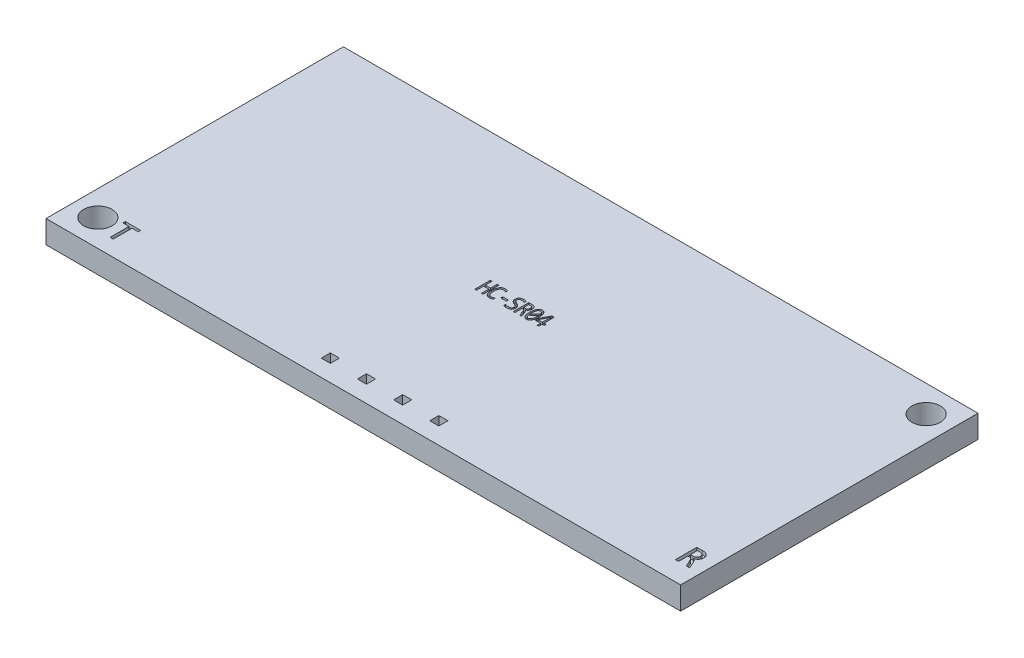
from build123d import *

# Parameters (mm, degrees)
CROQUIS1_W                = 44.6
CROQUIS1_H                = 20.9
CROQUIS1_R                = 1
SALIENTE_EXTRUIR2_DEPTH   = 1.6
CROQUIS3_W                = 0.396538249
CROQUIS3_H                = 0.136456535
CORTAR_EXTRUIR1_DEPTH     = 1
CORTAR_EXTRUIR2_DEPTH     = 1
CORTAR_EXTRUIR4_START     = 19.087831133
CORTAR_EXTRUIR4_OUTLINE_W = 0.636
CORTAR_EXTRUIR4_OUTLINE_H = 1.6
CORTAR_EXTRUIR4_DEPTH     = 0.636


# Read off the part's stored shape, not the designer's step: Cortar-Extruir4
with BuildPart() as part:
    # Croquis1 → Saliente-Extruir2 (new body)
    with BuildSketch(Plane(origin=(0, 0, 0), x_dir=(1, 0, 0), z_dir=(0, 1, 0))):
        with Locations((22.3, -10.45)):
            Rectangle(CROQUIS1_W, CROQUIS1_H)
        with Locations(Location((42.832264729, -1.877461796, 0), (0, 0, 90))):
            Circle(CROQUIS1_R, mode=Mode.SUBTRACT)
        with Locations(Location((1.767735271, -19.022538204, 0), (0, 0, 90))):
            Circle(CROQUIS1_R, mode=Mode.SUBTRACT)
    extrude(amount=SALIENTE_EXTRUIR2_DEPTH)

    # Croquis3 → Cortar-Extruir1 (cut)
    # profile 1 of 7: a face of its own
    with BuildSketch(Plane(origin=(0, 2.345630412, 0), x_dir=(1, 0, 0), z_dir=(0, 1, 0))):
        Polygon((19.973748759, -10.139175078), (19.85555223, -10.139175078), (19.85555223, -9.639492469), (19.491585885, -9.639492469), (19.491585885, -10.139175078), (19.373389357, -10.139175078), (19.373389357, -9.050730638), (19.491585885, -9.050730638), (19.491585885, -9.51117891), (19.85555223, -9.51117891), (19.85555223, -9.050730638), (19.973748759, -9.050730638), align=None)
    # profile 2 of 7: a face of its own
    with BuildSketch(Plane(origin=(0, 2.345630412, 0), x_dir=(1, 0, 0), z_dir=(0, 1, 0))):
        with BuildLine():
            add(Edge.make_bspline(
                [(20.627703747, -10.098460199), (20.610374513, -10.106830785), (20.576036478, -10.123417178), (20.521537795, -10.13980278), (20.466007679, -10.15052594), (20.428456832, -10.151839364), (20.409570697, -10.152499948)],
                knots=[0, 0, 0, 0, 1.016780851, 2.014760397, 3.001527137, 4, 4, 4, 4], degree=3))
            add(Edge.make_bspline(
                [(20.409570697, -10.152499948), (20.39465692, -10.15208389), (20.365590337, -10.151273003), (20.323405168, -10.144666469), (20.283735218, -10.13430462), (20.247044332, -10.118639649), (20.212594877, -10.099464237), (20.181120791, -10.075470597), (20.152214016, -10.047356337), (20.126323979, -10.014735686), (20.103006446, -9.978093614), (20.083106594, -9.937139926), (20.066300287, -9.892082291), (20.052668938, -9.842929051), (20.041790124, -9.789759097), (20.034348825, -9.73244375), (20.029538344, -9.671077827), (20.029067385, -9.628727093), (20.028824886, -9.606920565)],
                knots=[0, 0, 0, 0, 0.94991527, 1.851361422, 2.714727474, 3.555816217, 4.386716741, 5.22119729, 6.070041165, 6.950049518, 7.869063253, 8.832533837, 9.846022192, 10.929629904, 12.079947647, 13.301629003, 14.610600194, 16, 16, 16, 16], degree=3))
            add(Edge.make_bspline(
                [(20.028824886, -9.606920565), (20.02913283, -9.585605251), (20.029734219, -9.543978285), (20.035105795, -9.483180513), (20.043285805, -9.425527066), (20.055130364, -9.371190298), (20.070082002, -9.320362586), (20.088050162, -9.273275756), (20.108975535, -9.230214175), (20.132776184, -9.19121476), (20.159158875, -9.156100442), (20.188594306, -9.125492122), (20.220573705, -9.098916173), (20.25512076, -9.076612268), (20.292290991, -9.059037637), (20.331652122, -9.046310054), (20.373254643, -9.038766749), (20.401725625, -9.037865171), (20.416233132, -9.037405769)],
                knots=[0, 0, 0, 0, 1.327786852, 2.593052837, 3.799758175, 4.953719228, 6.054723051, 7.097814213, 8.090224973, 9.033298557, 9.940388262, 10.821139437, 11.672830083, 12.525753277, 13.376225029, 14.227067261, 15.096594778, 16, 16, 16, 16], degree=3))
            add(Edge.make_bspline(
                [(20.416233132, -9.037405769), (20.42610961, -9.037519394), (20.445565766, -9.037743231), (20.47414272, -9.04035822), (20.501702747, -9.044166247), (20.528193107, -9.049998382), (20.554088594, -9.057023787), (20.579125828, -9.066310923), (20.603893666, -9.076847165), (20.619705732, -9.08539472), (20.627703747, -9.08971822)],
                knots=[0, 0, 0, 0, 1.075434393, 2.11855081, 3.123295064, 4.103821156, 5.071119399, 6.04321857, 7.010226339, 8, 8, 8, 8], degree=3))
            Line((20.627703747, -9.08971822), (20.627703747, -9.235551515))
            add(Edge.make_bspline(
                [(20.627703747, -9.235551515), (20.619883315, -9.230327988), (20.604405836, -9.219990064), (20.580041401, -9.206768575), (20.555508459, -9.195053097), (20.53031524, -9.185621299), (20.504425004, -9.178129406), (20.477451322, -9.172694419), (20.449215803, -9.169416003), (20.429978142, -9.169092111), (20.420181241, -9.168927167)],
                knots=[0, 0, 0, 0, 1.018287338, 2.015300564, 2.999852889, 3.961395426, 4.92586479, 5.916687188, 6.939059753, 8, 8, 8, 8], degree=3))
            add(Edge.make_bspline(
                [(20.420181241, -9.168927167), (20.410201474, -9.169219047), (20.390661782, -9.169790529), (20.362032571, -9.175502999), (20.334895409, -9.184577407), (20.309213511, -9.197255313), (20.285522301, -9.213519679), (20.263242115, -9.2325703), (20.243291387, -9.255352245), (20.224949653, -9.28110542), (20.208755862, -9.310014929), (20.194625881, -9.342034766), (20.182435562, -9.376959121), (20.172036434, -9.414861319), (20.163922604, -9.455589523), (20.158395641, -9.499211419), (20.154893853, -9.545503213), (20.154420091, -9.577303214), (20.154177363, -9.593595696)],
                knots=[0, 0, 0, 0, 0.855273281, 1.674565732, 2.493523833, 3.304569701, 4.122676115, 4.953136449, 5.812823174, 6.713525341, 7.661447009, 8.65019893, 9.712535881, 10.832132285, 12.019525658, 13.272043004, 14.602352584, 16, 16, 16, 16], degree=3))
            add(Edge.make_bspline(
                [(20.154177363, -9.593595696), (20.154338864, -9.610709093), (20.15465208, -9.64389894), (20.15785116, -9.692006917), (20.163284456, -9.736805926), (20.17054721, -9.778381505), (20.180092772, -9.816769082), (20.191973021, -9.851888656), (20.205603043, -9.883931085), (20.221802242, -9.912456656), (20.239713442, -9.937951949), (20.2601867, -9.959684595), (20.282222121, -9.978615183), (20.306664603, -9.993580013), (20.332842984, -10.005720395), (20.361124586, -10.013971468), (20.391376179, -10.019025446), (20.412182096, -10.019663152), (20.422895567, -10.019991523)],
                knots=[0, 0, 0, 0, 1.444903631, 2.802256698, 4.068620316, 5.253899802, 6.363986019, 7.405050103, 8.381782208, 9.299254532, 10.170420753, 11.00583044, 11.814182952, 12.6159143, 13.417765975, 14.244002075, 15.095794184, 16, 16, 16, 16], degree=3))
            add(Edge.make_bspline(
                [(20.422895567, -10.019991523), (20.432031583, -10.01979181), (20.450269116, -10.019393139), (20.477288006, -10.016501149), (20.50369148, -10.011086348), (20.538276668, -10.002004237), (20.580458114, -9.985501774), (20.611868398, -9.967582824), (20.627703747, -9.958549068)],
                knots=[0, 0, 0, 0, 0.759244976, 1.51562283, 2.254279774, 2.997099975, 4.486101878, 6, 6, 6, 6], degree=3))
            Line((20.627703747, -9.958549068), (20.627703747, -10.098460199))
        make_face()
    # profile 3 of 7: a face of its own
    with BuildSketch(Plane(origin=(0, 2.345630412, 0), x_dir=(1, 0, 0), z_dir=(0, 1, 0))):
        with Locations((21.009362559, -9.685265863)):
            Rectangle(CROQUIS3_W, CROQUIS3_H)
    # profile 4 of 7: a face of its own
    with BuildSketch(Plane(origin=(0, 2.345630412, 0), x_dir=(1, 0, 0), z_dir=(0, 1, 0))):
        with BuildLine():
            add(Edge.make_bspline(
                [(21.964977789, -9.844300649), (21.964727816, -9.85681859), (21.96424079, -9.881207529), (21.959475467, -9.916593931), (21.951690118, -9.949643436), (21.940485658, -9.980122536), (21.926628422, -10.008147229), (21.910227077, -10.03385786), (21.891237934, -10.057027772), (21.86980133, -10.077746917), (21.845977132, -10.095803034), (21.819840497, -10.111359213), (21.791558346, -10.124821386), (21.760917845, -10.135544387), (21.728378053, -10.143898164), (21.694118807, -10.14970956), (21.658346829, -10.153566696), (21.633922717, -10.154004453), (21.621492262, -10.154227246)],
                knots=[0, 0, 0, 0, 1.143946885, 2.228773228, 3.257490168, 4.242423615, 5.190822466, 6.110768906, 7.024547349, 7.923349918, 8.830295116, 9.751132486, 10.699740016, 11.689199019, 12.71425371, 13.767606098, 14.863841063, 16, 16, 16, 16], degree=3))
            add(Edge.make_bspline(
                [(21.621492262, -10.154227246), (21.610055522, -10.154097619), (21.587155154, -10.153838061), (21.553137772, -10.151354904), (21.51988916, -10.147092542), (21.487695495, -10.143069396), (21.457170339, -10.137105329), (21.42845327, -10.131213185), (21.402077611, -10.124247862), (21.385413593, -10.119154404), (21.377449743, -10.116720206)],
                knots=[0, 0, 0, 0, 1.10764159, 2.217887345, 3.300931245, 4.354386625, 5.359118462, 6.312274127, 7.193424066, 8, 8, 8, 8], degree=3))
            Line((21.377449743, -10.116720206), (21.377449743, -9.973354479))
            add(Edge.make_bspline(
                [(21.377449743, -9.973354479), (21.385961702, -9.977156389), (21.403265715, -9.984885316), (21.430523227, -9.994795954), (21.459391264, -10.002941181), (21.489683673, -10.010552411), (21.521796149, -10.016564386), (21.556043563, -10.020185544), (21.592321795, -10.02322144), (21.617290062, -10.023369821), (21.630128751, -10.023446118)],
                knots=[0, 0, 0, 0, 0.861406788, 1.751159151, 2.677346762, 3.632377616, 4.637293902, 5.693351295, 6.813920619, 8, 8, 8, 8], degree=3))
            add(Edge.make_bspline(
                [(21.630128751, -10.023446118), (21.639261825, -10.023289532), (21.656892154, -10.022987261), (21.682289712, -10.02109601), (21.705638146, -10.017673039), (21.726958969, -10.012802235), (21.746278184, -10.006385862), (21.763699092, -9.998680467), (21.779422596, -9.989906571), (21.793076704, -9.979383241), (21.805126124, -9.967647805), (21.815358647, -9.954682024), (21.824035335, -9.940569827), (21.830565722, -9.925125193), (21.835833632, -9.90862139), (21.839111727, -9.890871669), (21.841466957, -9.872164981), (21.841717852, -9.859278617), (21.841846124, -9.852690382)],
                knots=[0, 0, 0, 0, 1.404098577, 2.710447872, 3.912180978, 5.028663621, 6.068319009, 7.03637822, 7.953897605, 8.828958909, 9.678430242, 10.53352976, 11.361940875, 12.217040393, 13.104890232, 14.019966617, 14.987695432, 16, 16, 16, 16], degree=3))
            add(Edge.make_bspline(
                [(21.841846124, -9.852690382), (21.841624316, -9.845598884), (21.841192933, -9.831807), (21.837422981, -9.811958152), (21.831334951, -9.793672857), (21.819361017, -9.771776744), (21.800170616, -9.746491337), (21.770571091, -9.720535195), (21.736358723, -9.69677455), (21.697538415, -9.676013951), (21.656507938, -9.655668972), (21.614502836, -9.634688421), (21.572714436, -9.61201678), (21.53145192, -9.588119046), (21.492591172, -9.560767923), (21.46390191, -9.533688846), (21.443770339, -9.509515309), (21.429768001, -9.490057536), (21.417880438, -9.468725469), (21.407014107, -9.446130395), (21.39820133, -9.421568436), (21.392572674, -9.394746007), (21.388662772, -9.365871307), (21.388266084, -9.345866361), (21.388060287, -9.335488037)],
                knots=[0, 0, 0, 0, 0.637470817, 1.239783534, 1.810780114, 2.363601841, 3.478050821, 4.646330104, 5.890315181, 7.218560764, 8.601877446, 10.011680591, 11.4420749, 12.878695735, 14.299795436, 15.707830168, 16.411798919, 17.128372925, 17.860818983, 18.605608944, 19.38263948, 20.201330074, 21.066871808, 22, 22, 22, 22], degree=3))
            add(Edge.make_bspline(
                [(21.388060287, -9.335488037), (21.38830875, -9.326182089), (21.38880297, -9.307671485), (21.39245218, -9.280038794), (21.398032039, -9.252600953), (21.406208602, -9.225518313), (21.416636982, -9.199098753), (21.430078241, -9.174230341), (21.445710158, -9.150723767), (21.464065335, -9.128940878), (21.48512542, -9.108870908), (21.509029258, -9.090726803), (21.535716839, -9.074785617), (21.565073317, -9.060841063), (21.597322477, -9.049363631), (21.632677591, -9.041346351), (21.670967503, -9.036715064), (21.697398106, -9.036031785), (21.711064996, -9.035678471)],
                knots=[0, 0, 0, 0, 0.899564052, 1.789336686, 2.690867308, 3.604212301, 4.521323683, 5.432172246, 6.332122928, 7.246540674, 8.180328174, 9.139476518, 10.141959944, 11.180727632, 12.277429298, 13.444592548, 14.678635015, 16, 16, 16, 16], degree=3))
            add(Edge.make_bspline(
                [(21.711064996, -9.035678471), (21.718719612, -9.035736868), (21.734547361, -9.035857617), (21.758969242, -9.038153523), (21.78444788, -9.040820888), (21.810287634, -9.04531917), (21.836200681, -9.049754446), (21.861577159, -9.055525642), (21.886030765, -9.061549909), (21.901820252, -9.066065985), (21.909457499, -9.068250374)],
                knots=[0, 0, 0, 0, 0.910573081, 1.882827667, 2.917346976, 3.958559882, 5.003080567, 6.045718943, 7.054729998, 8, 8, 8, 8], degree=3))
            Line((21.909457499, -9.068250374), (21.909457499, -9.20149907))
            add(Edge.make_bspline(
                [(21.909457499, -9.20149907), (21.892523351, -9.195747145), (21.85904464, -9.184375623), (21.807908467, -9.173158028), (21.757764955, -9.165535527), (21.724580816, -9.164498992), (21.708350671, -9.16399203)],
                knots=[0, 0, 0, 0, 1.043499382, 2.062992154, 3.052622143, 4, 4, 4, 4], degree=3))
            add(Edge.make_bspline(
                [(21.708350671, -9.16399203), (21.70020303, -9.164142215), (21.684376804, -9.16443394), (21.661472379, -9.166444833), (21.640150941, -9.169495303), (21.620620571, -9.174253954), (21.602683644, -9.180042103), (21.586546519, -9.187577599), (21.571906689, -9.196136904), (21.554928754, -9.209169372), (21.53750319, -9.22866729), (21.522029368, -9.255849082), (21.512961338, -9.287056756), (21.51195923, -9.309025005), (21.511438709, -9.320435869)],
                knots=[0, 0, 0, 0, 1.026072651, 1.993074859, 2.894123165, 3.73586976, 4.522109245, 5.263744802, 5.974417399, 6.654058664, 7.952321362, 9.237289499, 10.564978317, 12, 12, 12, 12], degree=3))
            add(Edge.make_bspline(
                [(21.511438709, -9.320435869), (21.511651939, -9.327529798), (21.51206664, -9.341326407), (21.515964439, -9.361193098), (21.521703185, -9.379783939), (21.533539592, -9.402147361), (21.553242856, -9.427491189), (21.582499105, -9.454146798), (21.616990441, -9.477676122), (21.655442559, -9.499001224), (21.696634052, -9.519070493), (21.73836921, -9.540559319), (21.780552108, -9.562684047), (21.821594107, -9.587375103), (21.860764332, -9.614997485), (21.889479811, -9.642769623), (21.909418738, -9.667554939), (21.923642724, -9.687235128), (21.935100237, -9.709178092), (21.945989462, -9.732113135), (21.954877548, -9.757064118), (21.960455978, -9.784308376), (21.964365266, -9.813590324), (21.964769156, -9.833840322), (21.964977789, -9.844300649)],
                knots=[0, 0, 0, 0, 0.632967962, 1.231026168, 1.802636371, 2.364578152, 3.481450398, 4.651394712, 5.886592745, 7.202628511, 8.576173962, 9.979350907, 11.396159054, 12.830181665, 14.255802925, 15.669158299, 16.379493605, 17.097012982, 17.833542787, 18.586384712, 19.364857951, 20.192117193, 21.066121124, 22, 22, 22, 22], degree=3))
        make_face()
    # profile 5 of 7: a face of its own
    with BuildSketch(Plane(origin=(0, 2.345630412, 0), x_dir=(1, 0, 0), z_dir=(0, 1, 0))):
        with BuildLine():
            Line((22.669024417, -10.139175078), (22.535528964, -10.139175078))
            Line((22.535528964, -10.139175078), (22.406228378, -9.791001171))
            add(Edge.make_bspline(
                [(22.406228378, -9.791001171), (22.401504201, -9.778737864), (22.392797916, -9.756137556), (22.377717078, -9.726014703), (22.361908153, -9.701863179), (22.344565876, -9.683391287), (22.325883867, -9.669408382), (22.30513571, -9.66049308), (22.282434482, -9.655472488), (22.266673164, -9.654863489), (22.258421028, -9.654544636)],
                knots=[0, 0, 0, 0, 1.448627921, 2.669706975, 3.708756312, 4.619923946, 5.450894126, 6.263237955, 7.090685483, 8, 8, 8, 8], degree=3))
            Line((22.258421028, -9.654544636), (22.202653981, -9.654544636))
            Line((22.202653981, -9.654544636), (22.202653981, -10.139175078))
            Line((22.202653981, -10.139175078), (22.08470421, -10.139175078))
            Line((22.08470421, -10.139175078), (22.08470421, -9.050730638))
            Line((22.08470421, -9.050730638), (22.3169024, -9.050730638))
            add(Edge.make_bspline(
                [(22.3169024, -9.050730638), (22.329087202, -9.050931403), (22.352621364, -9.051319168), (22.38657242, -9.055298715), (22.41782034, -9.061879995), (22.446438921, -9.071146505), (22.472697435, -9.082311906), (22.496293123, -9.096142025), (22.517779441, -9.111522835), (22.536246911, -9.129616521), (22.552882351, -9.149149827), (22.566557226, -9.171072282), (22.578357164, -9.194740154), (22.587579839, -9.220372026), (22.594643977, -9.247574369), (22.599927181, -9.276174929), (22.602819736, -9.306227828), (22.60319573, -9.326763486), (22.603387097, -9.337215335)],
                knots=[0, 0, 0, 0, 1.263078315, 2.439554657, 3.538662496, 4.569067683, 5.554652551, 6.490951183, 7.400247821, 8.287023195, 9.165059215, 10.054742257, 10.958783149, 11.903205161, 12.873502374, 13.870608934, 14.9162231, 16, 16, 16, 16], degree=3))
            add(Edge.make_bspline(
                [(22.603387097, -9.337215335), (22.602873514, -9.353712588), (22.601863755, -9.386147972), (22.593813108, -9.425647936), (22.585025438, -9.45554844), (22.576728335, -9.476701911), (22.56723147, -9.496907315), (22.556059819, -9.515910894), (22.543628493, -9.533826586), (22.529920495, -9.550655085), (22.514367146, -9.565983679), (22.497785147, -9.58030413), (22.479670892, -9.592944281), (22.460208454, -9.603815451), (22.439583046, -9.613361153), (22.424958984, -9.617936541), (22.417579193, -9.620245435)],
                knots=[0, 0, 0, 0, 1.899675516, 3.734967444, 4.625859039, 5.490377185, 6.351300429, 7.196894437, 8.028012615, 8.863230843, 9.694565318, 10.541964678, 11.386281995, 12.235377003, 13.109512117, 14, 14, 14, 14], degree=3))
            add(Edge.make_bspline(
                [(22.417579193, -9.620245435), (22.423527802, -9.623186591), (22.43559281, -9.629151864), (22.452028457, -9.641783), (22.466809678, -9.657491035), (22.480269453, -9.676240249), (22.492977007, -9.697997628), (22.506072035, -9.722653839), (22.519181585, -9.75064803), (22.527315483, -9.770644736), (22.531580855, -9.781130897)],
                knots=[0, 0, 0, 0, 0.786710659, 1.5956118, 2.445534242, 3.340471897, 4.330639444, 5.436289409, 6.655604345, 8, 8, 8, 8], degree=3))
            Line((22.531580855, -9.781130897), (22.669024417, -10.139175078))
        make_face()
        with BuildLine():
            add(Edge.make_bspline(
                [(22.480008674, -9.349553177), (22.479850546, -9.342475909), (22.479544677, -9.328786324), (22.477655484, -9.308960959), (22.474119881, -9.290584358), (22.469527408, -9.273431703), (22.463400469, -9.257712708), (22.455920183, -9.243353414), (22.446950872, -9.230508205), (22.433507321, -9.214956637), (22.412985714, -9.198849962), (22.383894921, -9.185160118), (22.350412513, -9.176929606), (22.326657315, -9.17605086), (22.314188075, -9.175589602)],
                knots=[0, 0, 0, 0, 0.928768235, 1.796519982, 2.609374705, 3.381814445, 4.123400958, 4.818611805, 5.501225219, 6.174387267, 7.51107262, 8.88692394, 10.365928421, 12, 12, 12, 12], degree=3))
            Line((22.314188075, -9.175589602), (22.202653981, -9.175589602))
            Line((22.202653981, -9.175589602), (22.202653981, -9.53536108))
            Line((22.202653981, -9.53536108), (22.29814888, -9.53536108))
            add(Edge.make_bspline(
                [(22.29814888, -9.53536108), (22.304980605, -9.535220153), (22.318270884, -9.534945996), (22.33770899, -9.532778824), (22.355976191, -9.528694346), (22.373301749, -9.523645213), (22.389559824, -9.516937606), (22.404488784, -9.508569656), (22.418266441, -9.498861484), (22.430694803, -9.48767956), (22.441753471, -9.475014259), (22.451799677, -9.461162365), (22.460063712, -9.445716351), (22.467362863, -9.429108697), (22.472935144, -9.411045691), (22.477168738, -9.391747086), (22.479671568, -9.371087008), (22.479893965, -9.356880612), (22.480008674, -9.349553177)],
                knots=[0, 0, 0, 0, 1.112165679, 2.163581322, 3.177401626, 4.156033109, 5.098542953, 6.033699398, 6.936563965, 7.837340752, 8.748114927, 9.669653972, 10.616529508, 11.594152706, 12.619055265, 13.688060552, 14.807538167, 16, 16, 16, 16], degree=3))
        make_face(mode=Mode.SUBTRACT)
    # profile 6 of 7: a face of its own
    with BuildSketch(Plane(origin=(0, 2.345630412, 0), x_dir=(1, 0, 0), z_dir=(0, 1, 0))):
        with BuildLine():
            add(Edge.make_bspline(
                [(23.328408056, -9.595322994), (23.328170544, -9.61564396), (23.327704726, -9.655498194), (23.324078965, -9.713904), (23.317526146, -9.769535077), (23.30916387, -9.822327851), (23.297851016, -9.871868357), (23.284040641, -9.917967197), (23.267904153, -9.960581666), (23.248905579, -9.999407838), (23.227567032, -10.034322856), (23.203574189, -10.065126566), (23.177251266, -10.091956901), (23.148098724, -10.114348102), (23.116618147, -10.132472606), (23.082236128, -10.145038316), (23.04533071, -10.152988276), (23.019757414, -10.153807134), (23.006637131, -10.154227246)],
                knots=[0, 0, 0, 0, 1.357675841, 2.662724255, 3.907448328, 5.099118596, 6.232279233, 7.299772356, 8.31220489, 9.273185692, 10.183688622, 11.041150977, 11.876635354, 12.687836999, 13.490129007, 14.293493132, 15.124483091, 16, 16, 16, 16], degree=3))
            add(Edge.make_bspline(
                [(23.006637131, -10.154227246), (22.995257621, -10.15388195), (22.972899304, -10.153203519), (22.940179089, -10.146815559), (22.909130054, -10.136324656), (22.879473173, -10.122059591), (22.851841591, -10.103020071), (22.826359446, -10.079550333), (22.802748961, -10.051943013), (22.781468155, -10.019760733), (22.762514788, -9.982983215), (22.745822514, -9.941563212), (22.731321324, -9.895532546), (22.719272934, -9.844823936), (22.71007122, -9.789240422), (22.703163989, -9.728965998), (22.699349526, -9.663723653), (22.69874925, -9.618687374), (22.698437833, -9.595322994)],
                knots=[0, 0, 0, 0, 0.766528366, 1.506065113, 2.23730171, 2.971392251, 3.717366624, 4.49062492, 5.300799975, 6.160527332, 7.085652774, 8.085535664, 9.167597243, 10.3363946, 11.596275856, 12.963704099, 14.42479945, 16, 16, 16, 16], degree=3))
            add(Edge.make_bspline(
                [(22.698437833, -9.595322994), (22.698670395, -9.574919482), (22.699124667, -9.5350645), (22.702798117, -9.476580347), (22.709295799, -9.420944171), (22.717702221, -9.367991291), (22.72903187, -9.318301773), (22.742661102, -9.271933851), (22.759323458, -9.22945649), (22.777851943, -9.190410566), (22.799397844, -9.155589983), (22.823094423, -9.124540281), (22.849700284, -9.097973489), (22.878769671, -9.075464364), (22.91043411, -9.057503145), (22.9448491, -9.044854818), (22.981602334, -9.036955775), (23.007007838, -9.03610982), (23.019962001, -9.035678471)],
                knots=[0, 0, 0, 0, 1.362325196, 2.661083464, 3.910491888, 5.101423412, 6.239235955, 7.311327433, 8.325112867, 9.283092232, 10.19303072, 11.054297677, 11.885371563, 12.696070326, 13.50264726, 14.305513362, 15.135988171, 16, 16, 16, 16], degree=3))
            add(Edge.make_bspline(
                [(23.019962001, -9.035678471), (23.031342242, -9.036022186), (23.053701995, -9.036697513), (23.086411771, -9.043108046), (23.11753429, -9.053526178), (23.147074289, -9.068131635), (23.174662944, -9.087140995), (23.200485192, -9.110372944), (23.223751039, -9.138476695), (23.245078914, -9.170829208), (23.26415132, -9.207718942), (23.280711555, -9.249272487), (23.295307857, -9.295352466), (23.307247464, -9.346097342), (23.316848568, -9.401541829), (23.32367038, -9.46176522), (23.327500938, -9.526921321), (23.328098202, -9.571958267), (23.328408056, -9.595322994)],
                knots=[0, 0, 0, 0, 0.765936473, 1.504902169, 2.235574123, 2.971542312, 3.716940662, 4.485877603, 5.303878175, 6.1675575, 7.091968584, 8.096213403, 9.177439442, 10.345334284, 11.60518128, 12.966048649, 14.42601578, 16, 16, 16, 16], degree=3))
        make_face()
        with BuildLine():
            add(Edge.make_bspline(
                [(23.211692069, -9.60025813), (23.211584883, -9.590879792), (23.211371362, -9.572197716), (23.210028917, -9.544231346), (23.208321779, -9.516678518), (23.206941425, -9.498428445), (23.206263418, -9.489464307)],
                knots=[0, 0, 0, 0, 1.014305449, 2.020542386, 3.027722671, 4, 4, 4, 4], degree=3))
            Line((23.206263418, -9.489464307), (22.839582748, -9.831962807))
            add(Edge.make_bspline(
                [(22.839582748, -9.831962807), (22.843160469, -9.845840129), (22.850142617, -9.872922591), (22.863701718, -9.911283706), (22.880272327, -9.945575328), (22.900202705, -9.974919877), (22.923688074, -9.998448023), (22.945729489, -10.013663252), (22.964874865, -10.022376052), (22.980284297, -10.026693664), (22.996498409, -10.029534511), (23.007611627, -10.029914214), (23.013299566, -10.030108553)],
                knots=[0, 0, 0, 0, 1.502976041, 2.933151785, 4.260622807, 5.488505231, 6.635567833, 7.729267678, 8.27771504, 8.834782928, 9.403621622, 10, 10, 10, 10], degree=3))
            add(Edge.make_bspline(
                [(23.013299566, -10.030108553), (23.020651199, -10.029781219), (23.035292866, -10.029129293), (23.056540259, -10.023757114), (23.076832321, -10.015208059), (23.095864039, -10.002957524), (23.113686239, -9.987279233), (23.130007686, -9.968226369), (23.145157414, -9.946108328), (23.158697683, -9.920492426), (23.170547007, -9.891550535), (23.181600591, -9.859585685), (23.190498889, -9.82420982), (23.19811907, -9.785661419), (23.204279313, -9.743835668), (23.208687473, -9.698795535), (23.211031202, -9.650539177), (23.211467174, -9.617368917), (23.211692069, -9.60025813)],
                knots=[0, 0, 0, 0, 0.678603396, 1.351520847, 2.012264261, 2.706024441, 3.433249104, 4.198377744, 5.018541674, 5.906103291, 6.870298325, 7.906333877, 9.02911302, 10.238099317, 11.536695605, 12.934443093, 14.418640929, 16, 16, 16, 16], degree=3))
        make_face(mode=Mode.SUBTRACT)
        with BuildLine():
            add(Edge.make_bspline(
                [(22.81515382, -9.590387857), (22.815139326, -9.598942179), (22.815110199, -9.616133467), (22.8153289, -9.641798888), (22.8159538, -9.667149258), (22.817070773, -9.683829222), (22.817621389, -9.692051677)],
                knots=[0, 0, 0, 0, 1.00914959, 2.028048747, 3.02791882, 4, 4, 4, 4], degree=3))
            Line((22.817621389, -9.692051677), (23.184302059, -9.351280475))
            add(Edge.make_bspline(
                [(23.184302059, -9.351280475), (23.180885958, -9.337702806), (23.1742653, -9.311388275), (23.160013112, -9.274696849), (23.14380923, -9.241685194), (23.123984473, -9.213560389), (23.101237364, -9.190255087), (23.079114289, -9.175913052), (23.060218183, -9.167708967), (23.045417887, -9.162786976), (23.029573949, -9.16048272), (23.018815599, -9.160029526), (23.013299566, -9.159797164)],
                knots=[0, 0, 0, 0, 1.508489605, 2.923564944, 4.236631042, 5.464735754, 6.618822608, 7.728454587, 8.280551701, 8.838813731, 9.40463532, 10, 10, 10, 10], degree=3))
            add(Edge.make_bspline(
                [(23.013299566, -9.159797164), (23.005947256, -9.160119378), (22.991384218, -9.160757603), (22.970116301, -9.166187771), (22.949869165, -9.174920336), (22.930813738, -9.187198137), (22.912837157, -9.202619801), (22.896532544, -9.221726069), (22.881443444, -9.244054794), (22.867963381, -9.269855594), (22.855995247, -9.298909691), (22.845003628, -9.331066967), (22.836150638, -9.366610507), (22.82839477, -9.40520692), (22.822681318, -9.447002609), (22.818115084, -9.491927034), (22.815825568, -9.540108249), (22.815382418, -9.57327756), (22.81515382, -9.590387857)],
                knots=[0, 0, 0, 0, 0.677903786, 1.342753224, 2.012786078, 2.705831022, 3.427328261, 4.191668087, 5.017261097, 5.910613136, 6.873814127, 7.915971342, 9.044945908, 10.252685793, 11.548853854, 12.937603547, 14.420271241, 16, 16, 16, 16], degree=3))
        make_face(mode=Mode.SUBTRACT)
    # profile 7 of 7: a face of its own
    with BuildSketch(Plane(origin=(0, 2.345630412, 0), x_dir=(1, 0, 0), z_dir=(0, 1, 0))):
        Polygon((24.019623328, -9.898587155), (23.871569222, -9.898587155), (23.871569222, -10.139175078), (23.75361945, -10.139175078), (23.75361945, -9.898587155), (23.336600384, -9.898587155), (23.336600384, -9.771013867), (23.705995379, -9.050730638), (23.871569222, -9.050730638), (23.871569222, -9.771013867), (24.019623328, -9.771013867), align=None)
        Polygon((23.75361945, -9.190641769), (23.45183583, -9.771013867), (23.75361945, -9.771013867), align=None, mode=Mode.SUBTRACT)
    extrude(amount=-CORTAR_EXTRUIR1_DEPTH, mode=Mode.SUBTRACT)

    # Croquis4 → Cortar-Extruir2 (cut)
    # profile 1 of 2: a face of its own
    with BuildSketch(Plane(origin=(0, 2.345630412, 0), x_dir=(1, 0, 0), z_dir=(0, 1, 0))):
        with BuildLine():
            Line((43.879153441, -19.541178178), (43.648854528, -19.541178178))
            Line((43.648854528, -19.541178178), (43.433161593, -19.072767852))
            add(Edge.make_bspline(
                [(43.433161593, -19.072767852), (43.425367702, -19.05616099), (43.410909065, -19.025353198), (43.385451544, -18.984899965), (43.359084622, -18.952306939), (43.33052326, -18.927249707), (43.29936373, -18.908969308), (43.265408631, -18.897142212), (43.228165384, -18.890267152), (43.202214706, -18.889438909), (43.188596376, -18.889004265)],
                knots=[0, 0, 0, 0, 1.339134837, 2.484261414, 3.482991323, 4.391871607, 5.244507385, 6.105289549, 7.005698766, 8, 8, 8, 8], degree=3))
            Line((43.188596376, -18.889004265), (43.096544746, -18.889004265))
            Line((43.096544746, -18.889004265), (43.096544746, -19.541178178))
            Line((43.096544746, -19.541178178), (42.879153441, -19.541178178))
            Line((42.879153441, -19.541178178), (42.879153441, -18.041178178))
            Line((42.879153441, -18.041178178), (43.277930615, -18.041178178))
            add(Edge.make_bspline(
                [(43.277930615, -18.041178178), (43.298890479, -18.041449738), (43.339301574, -18.041973312), (43.397651345, -18.047492676), (43.451438409, -18.056396529), (43.500579839, -18.069423054), (43.545408657, -18.085340507), (43.586078488, -18.104362182), (43.622594883, -18.126377831), (43.654818335, -18.151497873), (43.683304938, -18.178911388), (43.707210652, -18.209617902), (43.727482311, -18.242691906), (43.743391602, -18.278637697), (43.755454536, -18.316745534), (43.764458838, -18.356834768), (43.769485872, -18.39895171), (43.770130271, -18.427714351), (43.770457789, -18.44233307)],
                knots=[0, 0, 0, 0, 1.390037284, 2.680023546, 3.883960013, 5.002565466, 6.047913656, 7.03574216, 7.976084698, 8.870016629, 9.741095147, 10.591561451, 11.444313202, 12.308368875, 13.191986167, 14.092206828, 15.030357037, 16, 16, 16, 16], degree=3))
            add(Edge.make_bspline(
                [(43.770457789, -18.44233307), (43.770186335, -18.454119535), (43.769652487, -18.477299076), (43.765728637, -18.511570998), (43.759787261, -18.54490092), (43.750884838, -18.577134483), (43.739658463, -18.608146039), (43.72610027, -18.637911041), (43.709647153, -18.666100851), (43.691023022, -18.693009113), (43.66983205, -18.718201274), (43.646428571, -18.741762225), (43.620252915, -18.76313877), (43.592316075, -18.783223919), (43.561853936, -18.800995229), (43.529174335, -18.81617976), (43.494443568, -18.82924214), (43.470247781, -18.83576101), (43.457957789, -18.8390722)],
                knots=[0, 0, 0, 0, 1.032708305, 2.030948508, 3.019625047, 3.996933367, 4.957424013, 5.907556856, 6.85893238, 7.814077788, 8.77200233, 9.740252168, 10.719774328, 11.730219428, 12.753012585, 13.805036997, 14.885091985, 16, 16, 16, 16], degree=3))
            add(Edge.make_bspline(
                [(43.457957789, -18.8390722), (43.467947013, -18.842736026), (43.4877663, -18.850005303), (43.515016285, -18.866193186), (43.540645913, -18.885009285), (43.563059606, -18.909056199), (43.584974238, -18.936141383), (43.606696993, -18.967350684), (43.628756119, -19.002570102), (43.642647312, -19.027966763), (43.64987355, -19.041178178)],
                knots=[0, 0, 0, 0, 0.890820497, 1.767447404, 2.649001527, 3.549193506, 4.515009134, 5.571837998, 6.736863216, 8, 8, 8, 8], degree=3))
            Line((43.64987355, -19.041178178), (43.879153441, -19.541178178))
        make_face()
        with BuildLine():
            add(Edge.make_bspline(
                [(43.553066485, -18.456939048), (43.552907449, -18.447078705), (43.55259931, -18.42797384), (43.549188716, -18.400318915), (43.543352611, -18.374642706), (43.535578394, -18.350849986), (43.525865337, -18.328716589), (43.512983508, -18.309005351), (43.498443474, -18.290869658), (43.481648375, -18.274784385), (43.462733748, -18.260791401), (43.441951683, -18.248629716), (43.41949485, -18.23802733), (43.395143479, -18.229470804), (43.36892897, -18.223215239), (43.340924399, -18.218338038), (43.311040916, -18.215745089), (43.290502896, -18.215312898), (43.279968659, -18.215091222)],
                knots=[0, 0, 0, 0, 1.136086502, 2.201219443, 3.204852043, 4.166451082, 5.083443327, 5.98129036, 6.87199526, 7.758098985, 8.653381414, 9.577773354, 10.529401831, 11.511765708, 12.546811162, 13.632454437, 14.78565276, 16, 16, 16, 16], degree=3))
            Line((43.279968659, -18.215091222), (43.096544746, -18.215091222))
            Line((43.096544746, -18.215091222), (43.096544746, -18.715091222))
            Line((43.096544746, -18.715091222), (43.253813767, -18.715091222))
            add(Edge.make_bspline(
                [(43.253813767, -18.715091222), (43.265027644, -18.714890806), (43.286932825, -18.714499313), (43.318887033, -18.71159575), (43.348990694, -18.705867441), (43.377542496, -18.69909321), (43.404127045, -18.689485562), (43.428608286, -18.677862042), (43.451398194, -18.664701785), (43.471679852, -18.648900658), (43.490275255, -18.631525488), (43.506550149, -18.612127961), (43.520708009, -18.590882965), (43.532138539, -18.56750072), (43.541899832, -18.542504341), (43.548043336, -18.515362445), (43.552372726, -18.486742918), (43.552831507, -18.467033702), (43.553066485, -18.456939048)],
                knots=[0, 0, 0, 0, 1.202615583, 2.349188572, 3.435207305, 4.486530095, 5.492783739, 6.45958443, 7.390413995, 8.308405015, 9.210274755, 10.115082188, 11.017605575, 11.940721498, 12.901403136, 13.887978084, 14.918265918, 16, 16, 16, 16], degree=3))
        make_face(mode=Mode.SUBTRACT)
    # profile 2 of 2: a face of its own
    with BuildSketch(Plane(origin=(0, 2.345630412, 0), x_dir=(1, 0, 0), z_dir=(0, 1, 0))):
        Polygon((4.051997322, -18.468631957), (3.617214713, -18.468631957), (3.617214713, -19.794718913), (3.399823409, -19.794718913), (3.399823409, -18.468631957), (2.9650408, -18.468631957), (2.9650408, -18.294718913), (4.051997322, -18.294718913), align=None)
    extrude(amount=-CORTAR_EXTRUIR2_DEPTH, mode=Mode.SUBTRACT)

    # Cortar-Extruir4 outline → Cortar-Extruir4 (cut)
    with BuildSketch(Plane.XY.offset(CORTAR_EXTRUIR4_START)):
        with Locations((18.4885, 0.8)):
            Rectangle(CORTAR_EXTRUIR4_OUTLINE_W, CORTAR_EXTRUIR4_OUTLINE_H)
        with Locations((21.0295, 0.8)):
            Rectangle(CORTAR_EXTRUIR4_OUTLINE_W, CORTAR_EXTRUIR4_OUTLINE_H)
        with Locations((23.5705, 0.8)):
            Rectangle(CORTAR_EXTRUIR4_OUTLINE_W, CORTAR_EXTRUIR4_OUTLINE_H)
        with Locations((26.1115, 0.8)):
            Rectangle(CORTAR_EXTRUIR4_OUTLINE_W, CORTAR_EXTRUIR4_OUTLINE_H)
    extrude(amount=CORTAR_EXTRUIR4_DEPTH, mode=Mode.SUBTRACT)


solid = part.part
